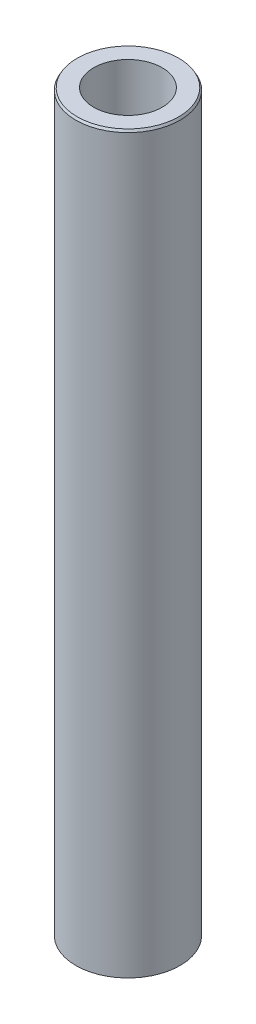
from build123d import *
from OCP.BRepFilletAPI import BRepFilletAPI_MakeChamfer

# Parameters (mm, degrees)
SKETCH1_R           = 42.5
BOSS_EXTRUDE1_DEPTH = 600
SKETCH2_R           = 27.958090213
CUT_EXTRUDE1_DEPTH  = 604.002902149
CHAMFER1_SIZE       = 1.866021218
CHAMFER1_SIZE2      = 1.077347852


with BuildPart() as part:
    # Sketch1 → Boss-Extrude1 (new body)
    with BuildSketch(Plane(origin=(0, 0, 0), x_dir=(1, 0, 0), z_dir=(0, 1, 0))):
        Circle(SKETCH1_R)
    extrude(amount=BOSS_EXTRUDE1_DEPTH)

    # Sketch2 → Cut-Extrude1 (cut, through all)
    with BuildSketch(Plane(origin=(0, 0, 0), x_dir=(1, 0, 0), z_dir=(0, 1, 0))):
        Circle(SKETCH2_R)
    extrude(amount=CUT_EXTRUDE1_DEPTH, mode=Mode.SUBTRACT)

    # Chamfer1: one chamfer whose edges measure the first distance from different faces: ONE call of the kernel's chamfer builder (chamfer() names one face for all edges)
    chamfer1_edges_1 = [part.edges().sort_by_distance(p)[0] for p in [
        (-42.5, 600, 0),
    ]]
    chamfer1_side_1 = [part.faces().sort_by_distance(p)[0] for p in [
        (-42.5, 300, 0),
    ]]
    chamfer1_edges_2 = [part.edges().sort_by_distance(p)[0] for p in [
        (-42.5, 0, 0),
    ]]
    chamfer1_side_2 = [part.faces().sort_by_distance(p)[0] for p in [
        (-41.297918472, 0, 0),
    ]]
    chamfer1 = BRepFilletAPI_MakeChamfer(part.part.solid().wrapped)
    for e in chamfer1_edges_1:
        chamfer1.Add(CHAMFER1_SIZE, CHAMFER1_SIZE2, e.wrapped, chamfer1_side_1[0].wrapped)  # the first distance lies on this face
    for e in chamfer1_edges_2:
        chamfer1.Add(CHAMFER1_SIZE, CHAMFER1_SIZE2, e.wrapped, chamfer1_side_2[0].wrapped)  # the first distance lies on this face
    add(Compound.cast(chamfer1.Shape()), mode=Mode.REPLACE)


solid = part.part
